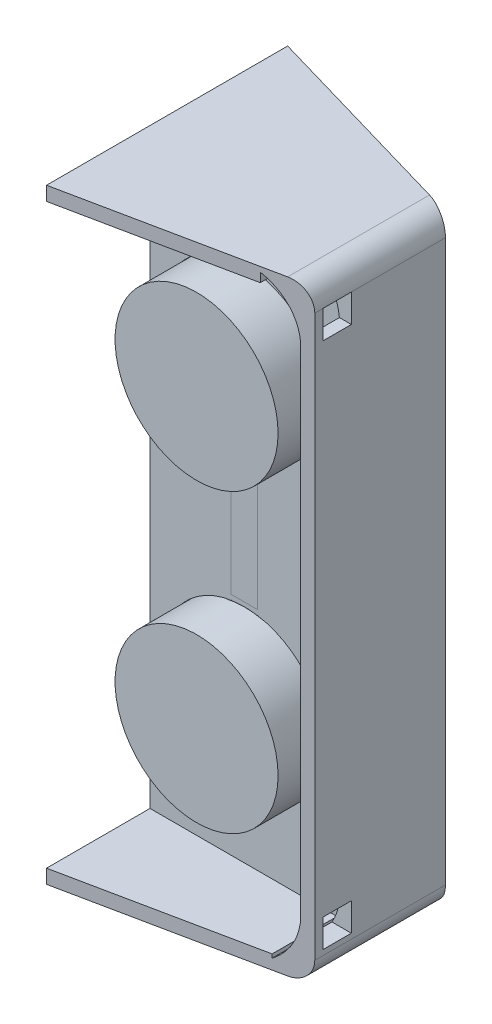
from build123d import *

# Parameters (mm, degrees)
SKETCH7_R                = 36.83
SKETCH7_R_2              = 1.905
BOSS_EXTRUDE1_DEPTH      = 6.35
BOSS_EXTRUDE2_DEPTH      = 25.4
BOSS_EXTRUDE2_DEPTH_BACK = 0.000254
SKETCH8_R                = 36.83
SKETCH9_R                = 34.925
CUT_EXTRUDE4_DEPTH       = 25.4
BOSS_EXTRUDE3_START      = -3.175
BOSS_EXTRUDE3_DEPTH      = 3.175
BOSS_EXTRUDE4_DEPTH      = 38.1
BOSS_EXTRUDE4_DEPTH_BACK = 40.64
CUT_EXTRUDE5_START       = -20.32
SKETCH12_W               = 34.495809925
SKETCH12_H               = 261.703089784
CUT_EXTRUDE5_DEPTH       = 48.26
BOSS_EXTRUDE7_DEPTH      = 66.04
BOSS_EXTRUDE7_DEPTH_BACK = 55.88
SKETCH18_W               = 80.102069995
SKETCH18_H               = 6.35
SKETCH18_W_2             = 84.52860838
CUT_EXTRUDE7_DEPTH       = 356.972524642
SKETCH19_W               = 12.7
SKETCH19_H               = 12.7
CUT_EXTRUDE8_DEPTH       = 45.72
SKETCH20_W               = 18.203212612
SKETCH20_H               = 62.726676146
CUT_EXTRUDE9_DEPTH       = 6.35
CUT_EXTRUDE9_DRAFT       = -26
SKETCH23_R               = 1.905
CUT_EXTRUDE10_DEPTH      = 267.372206393
SKETCH24_W               = 16.196066748
SKETCH24_H               = 62.242020171
BOSS_EXTRUDE10_DEPTH     = 3.81


with BuildPart() as part:
    # Sketch7 → Boss-Extrude1 (new body)
    with BuildSketch(Plane.XY):
        with BuildLine():
            Line((117.378076693, -136.321789995), (117.378076693, 124.616910866))
            Line((117.378076693, 124.616910866), (117.378076693, 130.966910866))
            Line((117.378076693, 130.966910866), (187.228076693, 130.966910866))
            ThreePointArc((187.228076693, 130.966910866), (205.188588935, 123.527423108), (212.628076693, 105.566910866))
            Line((212.628076693, 105.566910866), (212.628076693, -117.271789995))
            ThreePointArc((212.628076693, -117.271789995), (205.188588935, -135.232302238), (187.228076693, -142.671789995))
            Line((187.228076693, -142.671789995), (117.378076693, -142.671789995))
            Line((117.378076693, -142.671789995), (117.378076693, -136.321789995))
        make_face()
        with Locations((159.923076693, 61.116910866)):
            Circle(SKETCH7_R, mode=Mode.SUBTRACT)
        with Locations((159.923076693, -72.821789995)):
            Circle(SKETCH7_R, mode=Mode.SUBTRACT)
        with Locations((198.520756421, 117.007578537)):
            Circle(SKETCH7_R_2, mode=Mode.SUBTRACT)
        with Locations((198.520756421, -128.598951794)):
            Circle(SKETCH7_R_2, mode=Mode.SUBTRACT)
    extrude(amount=BOSS_EXTRUDE1_DEPTH)

    # Sketch8 → Boss-Extrude2 (add, two sides: drawn at the far end of the back side and taken through both)
    with BuildSketch(Plane.XY.offset(2.54).offset(-BOSS_EXTRUDE2_DEPTH_BACK)):
        with Locations((160.02, 60.978458264)):
            Circle(SKETCH8_R)
        with Locations((160.02, -72.960242597)):
            Circle(SKETCH8_R)
    extrude(amount=BOSS_EXTRUDE2_DEPTH + BOSS_EXTRUDE2_DEPTH_BACK)

    # Sketch9 → Cut-Extrude4 (cut)
    with BuildSketch(Plane(origin=(0, 0, 0), x_dir=(-1, 0, 0), z_dir=(0, 0, -1))):
        with Locations((-160.02, 60.978458264)):
            Circle(SKETCH9_R)
        with Locations((-160.02, -72.960242597)):
            Circle(SKETCH9_R)
    extrude(amount=-CUT_EXTRUDE4_DEPTH, mode=Mode.SUBTRACT)

    # Sketch10 → Boss-Extrude3 (add)
    with BuildSketch(Plane.XY.offset(6.35).offset(BOSS_EXTRUDE3_START)):
        with BuildLine():
            Line((187.228076693, 130.966910866), (187.228076693, 105.566910866))
            Line((187.228076693, 105.566910866), (212.628076693, 105.566910866))
            ThreePointArc((212.628076693, 105.566910866), (205.188588935, 123.527423108), (187.228076693, 130.966910866))
        make_face()
        with BuildLine():
            Line((212.628076693, -117.271789995), (187.228076693, -117.271789995))
            Line((187.228076693, -117.271789995), (187.228076693, -142.671789995))
            ThreePointArc((187.228076693, -142.671789995), (205.188588935, -135.232302238), (212.628076693, -117.271789995))
        make_face()
    extrude(amount=BOSS_EXTRUDE3_DEPTH)

    # Sketch11 → Boss-Extrude4 (add, two sides: drawn at the far end of the back side and taken through both)
    with BuildSketch(Plane(origin=(0, 0, 0), x_dir=(-1, 0, 0), z_dir=(0, 0, -1)).offset(-BOSS_EXTRUDE4_DEPTH_BACK)):
        with BuildLine():
            Line((-217.892216682, -132.511789995), (-217.892216682, 120.806910866))
            ThreePointArc((-217.892216682, 120.806910866), (-214.916421579, 127.991115763), (-207.732216682, 130.966910866))
            Line((-207.732216682, 130.966910866), (-187.228076693, 130.966910866))
            ThreePointArc((-187.228076693, 130.966910866), (-205.188588935, 123.527423108), (-212.628076693, 105.566910866))
            Line((-212.628076693, 105.566910866), (-212.628076693, -117.271789995))
            ThreePointArc((-212.628076693, -117.271789995), (-205.188588935, -135.232302238), (-187.228076693, -142.671789995))
            Line((-187.228076693, -142.671789995), (-207.732216682, -142.671789995))
            ThreePointArc((-207.732216682, -142.671789995), (-214.916421579, -139.695994892), (-217.892216682, -132.511789995))
        make_face()
    extrude(amount=BOSS_EXTRUDE4_DEPTH + BOSS_EXTRUDE4_DEPTH_BACK)

    # Sketch12 → Cut-Extrude5 (cut)
    with BuildSketch(Plane.XY.offset(6.35).offset(CUT_EXTRUDE5_START)):
        with Locations((195.299001462, -6.234634026)):
            Rectangle(SKETCH12_W, SKETCH12_H)
    extrude(amount=-CUT_EXTRUDE5_DEPTH, mode=Mode.SUBTRACT)

    # Sketch18 → Boss-Extrude7 (add, two sides: drawn at the far end of the back side and taken through both)
    with BuildSketch(Plane(origin=(0, 0, 0), x_dir=(-1, 0, 0), z_dir=(0, 0, -1)).offset(-BOSS_EXTRUDE7_DEPTH_BACK)):
        with Locations((-157.429111691, 127.791910866)):
            Rectangle(SKETCH18_W, SKETCH18_H)
        with Locations((-159.642380883, -139.496789995)):
            Rectangle(SKETCH18_W_2, SKETCH18_H)
    extrude(amount=BOSS_EXTRUDE7_DEPTH + BOSS_EXTRUDE7_DEPTH_BACK)

    # Sketch16 → Cut-Extrude7 (cut, through all)
    with BuildSketch(Plane(origin=(0, 130.966910866, 0), x_dir=(1, 0, 0), z_dir=(0, 1, 0))):
        Polygon((217.892216682, 26.67), (-157.890777654, 135.852004964), (217.892216682, 135.852004964), align=None)
        Polygon((217.892216682, -32.396277701), (47.594152328, -67.47666805), (217.892216682, -67.47666805), align=None)
    extrude(amount=-CUT_EXTRUDE7_DEPTH, mode=Mode.SUBTRACT)

    # Sketch19 → Cut-Extrude8 (cut)
    with BuildSketch(Plane(origin=(217.892216682, 0, 0), x_dir=(0, 0, -1), z_dir=(1, 0, 0))):
        with Locations((-22.215809399, -123.786574298)):
            Rectangle(SKETCH19_W, SKETCH19_H)
        with Locations((-22.215809399, 114.456910866)):
            Rectangle(SKETCH19_W, SKETCH19_H)
    extrude(amount=-CUT_EXTRUDE8_DEPTH, mode=Mode.SUBTRACT)


with BuildPart() as cut_extrude9_tool:
    # Sketch20 → Cut-Extrude9 (with draft: the straight prism first)
    with BuildSketch(Plane(origin=(0, 0, 0), x_dir=(-1, 0, 0), z_dir=(0, 0, -1))):
        with Locations((-159.923076693, -5.934095423)):
            Rectangle(SKETCH20_W, SKETCH20_H)
    extrude(amount=-CUT_EXTRUDE9_DEPTH)
    # Cut-Extrude9: the draft: its side faces are tilted about the plane it starts from
    cut_extrude9_sides = [cut_extrude9_tool.faces().sort_by_distance(p)[0] for p in [
        (169.024682999, -5.934095423, 3.175),
        (159.923076693, -37.297433496, 3.175),
        (150.821470387, -5.934095423, 3.175),
        (159.923076693, 25.42924265, 3.175),
    ]]
    draft(cut_extrude9_sides, Plane(origin=(0, 0, 0), x_dir=(-1, 0, 0), z_dir=(0, 0, -1)), CUT_EXTRUDE9_DRAFT)


with BuildPart() as part_1:
    add(part.part)

    # Cut-Extrude9: cut by cut_extrude9_tool
    add(cut_extrude9_tool.part, mode=Mode.SUBTRACT)

    # Sketch23 → Cut-Extrude10 (cut, through all)
    with BuildSketch(Plane(origin=(0, 0, 0), x_dir=(-1, 0, 0), z_dir=(0, 0, -1))):
        with Locations((-198.520756421, 117.007578537)):
            Circle(SKETCH23_R)
        with Locations((-198.520756421, -128.598951794)):
            Circle(SKETCH23_R)
    extrude(amount=-CUT_EXTRUDE10_DEPTH, mode=Mode.SUBTRACT)

    # Sketch24 → Boss-Extrude10 (add)
    with BuildSketch(Plane(origin=(0, 0, 2.539746), x_dir=(-1, 0, 0), z_dir=(0, 0, -1))):
        with Locations((-160.078035159, -5.897511229)):
            Rectangle(SKETCH24_W, SKETCH24_H)
    extrude(amount=-BOSS_EXTRUDE10_DEPTH)


solid = part_1.part
